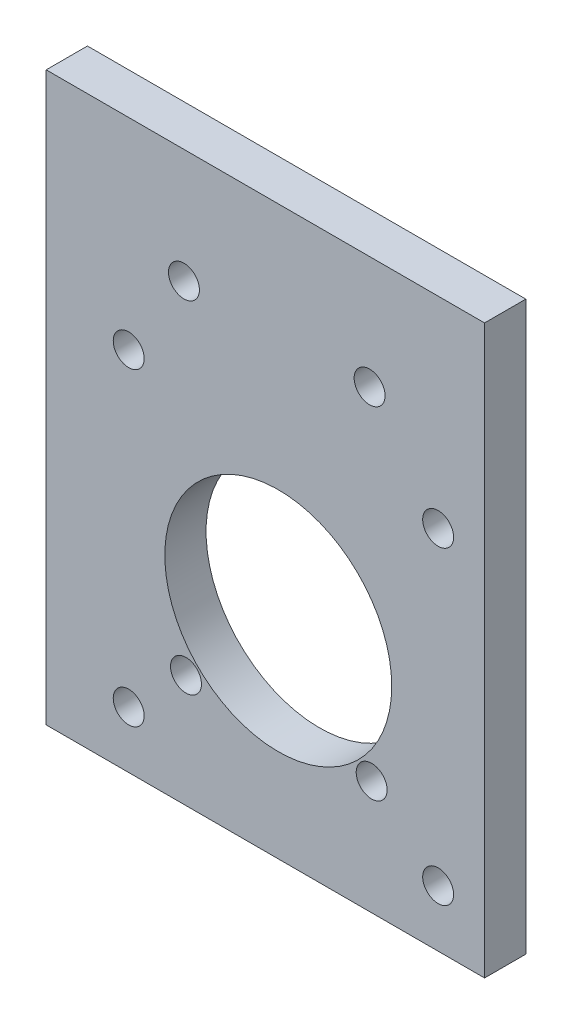
from build123d import *

# Parameters (mm, degrees)
SKETCH1_W           = 42.5
SKETCH1_H           = 40
BOSS_EXTRUDE1_DEPTH = 2
SKETCH2_R           = 1.5
CUT_EXTRUDE1_DEPTH  = 4
SKETCH3_R           = 11
CUT_EXTRUDE2_DEPTH  = 4
SKETCH4_W           = 42.5
SKETCH4_H           = 4
BOSS_EXTRUDE2_DEPTH = 15
SKETCH7_R           = 1.5
CUT_EXTRUDE3_DEPTH  = 10


with BuildPart() as part:
    # Sketch1 → Boss-Extrude1 (new, symmetric)
    with BuildSketch(Plane.XY):
        Rectangle(SKETCH1_W, SKETCH1_H)
    extrude(amount=BOSS_EXTRUDE1_DEPTH, both=True)

    # Sketch2 → Cut-Extrude1 (cut)
    with BuildSketch(Plane(origin=(0, 0, -2), x_dir=(-1, 0, 0), z_dir=(0, 0, -1))):
        with Locations((-16.75, 15.5)):
            Circle(SKETCH2_R)
        with Locations((13.25, 15.5)):
            Circle(SKETCH2_R)
        with Locations((13.25, -14.5)):
            Circle(SKETCH2_R)
        with Locations((-16.75, -14.5)):
            Circle(SKETCH2_R)
    extrude(amount=-CUT_EXTRUDE1_DEPTH, mode=Mode.SUBTRACT)

    # Sketch3 → Cut-Extrude2 (cut)
    with BuildSketch(Plane.XY.offset(2)):
        with Locations((1.25, 0)):
            Circle(SKETCH3_R)
    extrude(amount=-CUT_EXTRUDE2_DEPTH, mode=Mode.SUBTRACT)

    # Sketch4 → Boss-Extrude2 (add)
    with BuildSketch(Plane(origin=(0, 20, 0), x_dir=(1, 0, 0), z_dir=(0, 1, 0))):
        Rectangle(SKETCH4_W, SKETCH4_H)
    extrude(amount=BOSS_EXTRUDE2_DEPTH)

    # Sketch7 → Cut-Extrude3 (cut)
    with BuildSketch(Plane.XY.offset(2)):
        with Locations((-7.894013049, 23.945501151)):
            Circle(SKETCH7_R)
        with Locations((10.105662158, 24.053632735)):
            Circle(SKETCH7_R)
        with Locations((10.303903396, -8.945771811)):
            Circle(SKETCH7_R)
        with Locations((-7.695771811, -9.053903396)):
            Circle(SKETCH7_R)
    extrude(amount=-CUT_EXTRUDE3_DEPTH, mode=Mode.SUBTRACT)


solid = part.part
